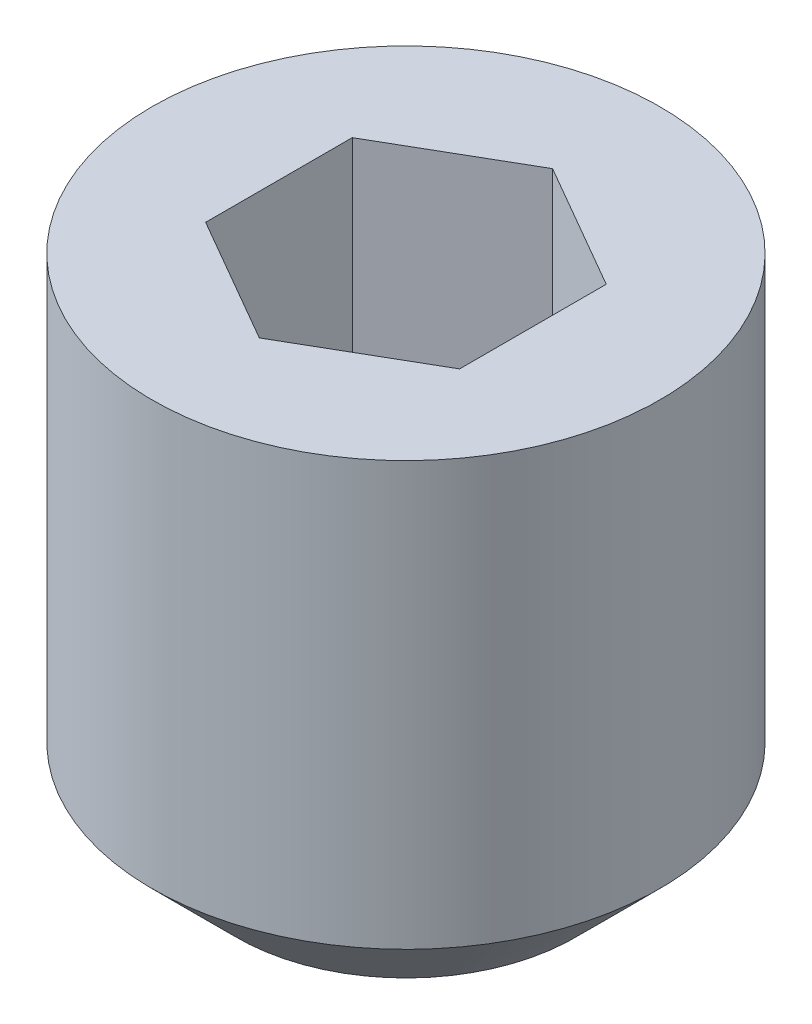
from build123d import *

# Parameters (mm, degrees)
SKETCH1_W          = 1.5
SKETCH1_H          = 3
CUT_EXTRUDE1_DEPTH = 1.2


with BuildPart() as part:
    # Sketch1 → Revolve1 (revolve)
    with BuildSketch(Plane.XY):
        with Locations((0.75, 1.5)):
            Rectangle(SKETCH1_W, SKETCH1_H)
    revolve(axis=Axis((0, 3, 0), (0, -1, 0)))

    # Sketch2 → Cut-Revolve1 (revolve, cut)
    with BuildSketch(Plane.XY):
        Polygon((0, 3), (0.75, 3), (0.75, 1.8), (0, 1.366987298), align=None)
    revolve(axis=Axis((0, 3, 0), (0, -1, 0)), mode=Mode.SUBTRACT)

    # Sketch3 → Cut-Extrude1 (cut)
    with BuildSketch(Plane(origin=(0, 3, 0), x_dir=(1, 0, 0), z_dir=(0, 1, 0))):
        Polygon((0, 0.866025404), (-0.75, 0.433012702), (-0.75, -0.433012702), (0, -0.866025404), (0.75, -0.433012702), (0.75, 0.433012702), align=None)
    extrude(amount=-CUT_EXTRUDE1_DEPTH, mode=Mode.SUBTRACT)

    # Sketch4 → Cut-Revolve2 (revolve, cut)
    with BuildSketch(Plane.XY):
        Polygon((1.5, 0.5), (1.5, 0), (1, 0), align=None)
    revolve(axis=Axis((0, 3, 0), (0, -1, 0)), mode=Mode.SUBTRACT)


solid = part.part
